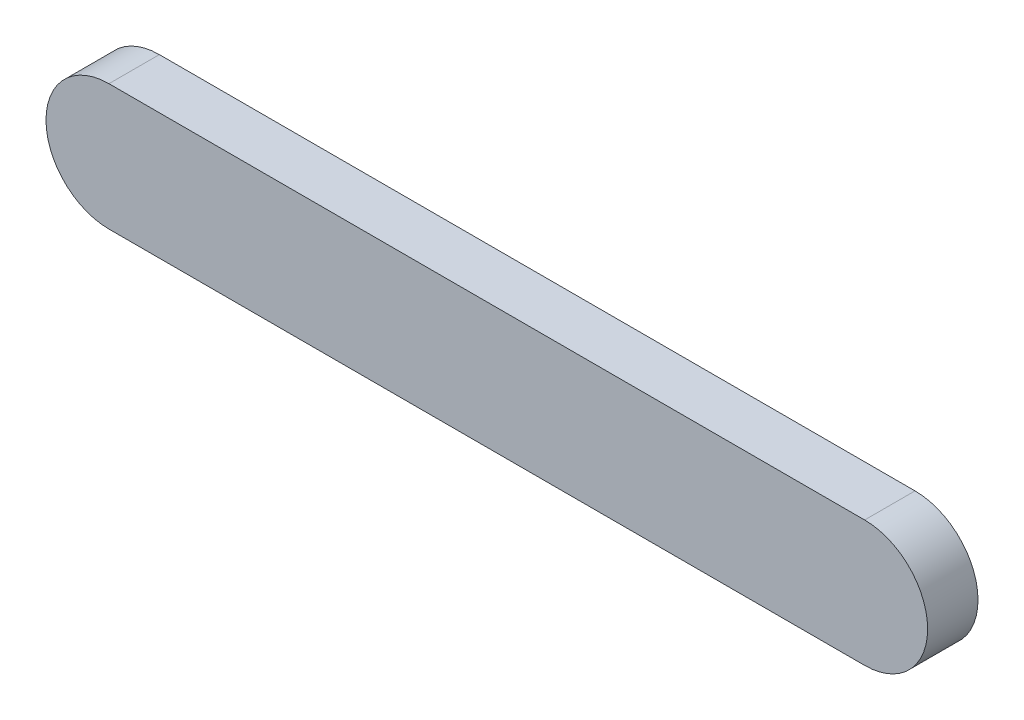
from build123d import *

# Parameters (mm, degrees)
BOSS_EXTRUDE1_DEPTH = 1


with BuildPart() as part:
    # Sketch1 → Boss-Extrude1 (new, symmetric)
    with BuildSketch(Plane.XY):
        with BuildLine():
            Line((0, 2.5), (30, 2.5))
            ThreePointArc((30, 2.5), (32.5, 0), (30, -2.5))
            Line((30, -2.5), (0, -2.5))
            ThreePointArc((0, -2.5), (-2.5, 0), (0, 2.5))
        make_face()
    extrude(amount=BOSS_EXTRUDE1_DEPTH, both=True)


solid = part.part
